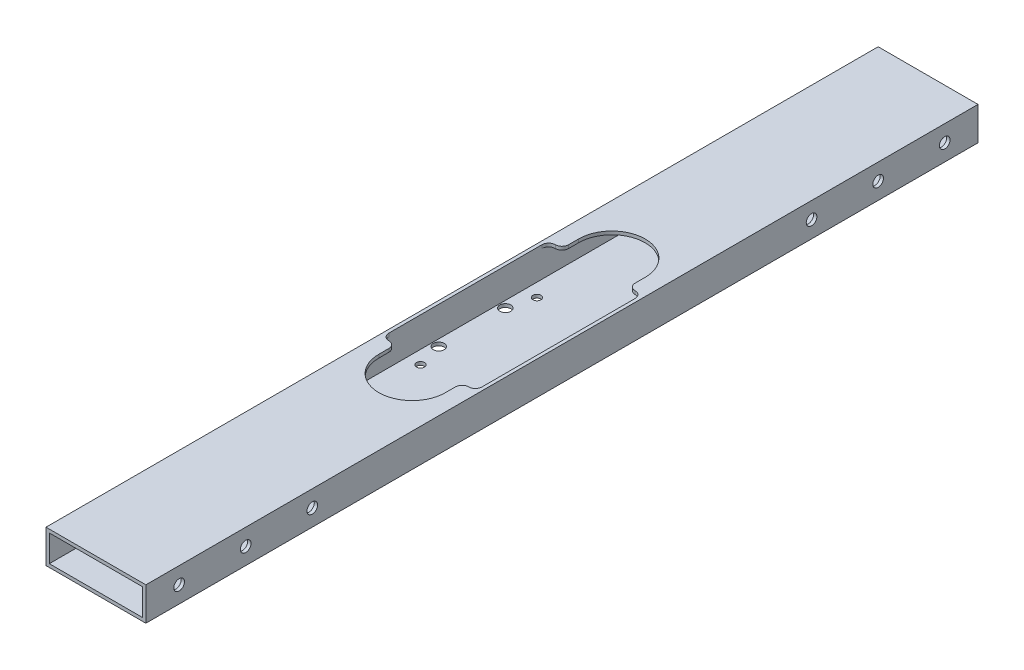
from build123d import *

# Parameters (mm, degrees)
SKETCH_1_W          = 30
SKETCH_1_H          = 10
SKETCH_1_W_2        = 27
SKETCH_1_H_2        = 7
EXTRUDE_1_DEPTH     = 250
SKETCH_2_R          = 1.6
CUT_EXTRUDE_1_DEPTH = 252.843205189
SKETCH_6_W          = 28
SKETCH_6_H          = 8
CUT_EXTRUDE_5_DEPTH = 330
SKETCH_8_W          = 4
SKETCH_8_H          = 25
CUT_EXTRUDE_6_DEPTH = 5
SKETCH_10_R         = 1.65
SKETCH_10_W         = 40
SKETCH_10_H         = 39.7
CUT_EXTRUDE_7_DEPTH = 25
FILLET_1_R          = 2
SKETCH_11_R         = 1.2
CUT_EXTRUDE_8_DEPTH = 25


with BuildPart() as part:
    # 草图1 → 凸台-拉伸1 (new body)
    with BuildSketch(Plane.XY):
        Rectangle(SKETCH_1_W, SKETCH_1_H)
        Rectangle(SKETCH_1_W_2, SKETCH_1_H_2, mode=Mode.SUBTRACT)
    extrude(amount=EXTRUDE_1_DEPTH)

    # 草图2 → 切除-拉伸1 (cut, through all)
    with BuildSketch(Plane(origin=(15, 0, 0), x_dir=(0, 0, -1), z_dir=(1, 0, 0))):
        with Locations((-240, 0)):
            Circle(SKETCH_2_R)
        with Locations((-220, 0)):
            Circle(SKETCH_2_R)
        with Locations((-200, 0)):
            Circle(SKETCH_2_R)
        with Locations((-50, 0)):
            Circle(SKETCH_2_R)
        with Locations((-30, 0)):
            Circle(SKETCH_2_R)
        with Locations((-10, 0)):
            Circle(SKETCH_2_R)
    extrude(amount=-CUT_EXTRUDE_1_DEPTH, mode=Mode.SUBTRACT)

    # 草图6 → 切除-拉伸5 (cut)
    with BuildSketch(Plane(origin=(0, 0, 0), x_dir=(-1, 0, 0), z_dir=(0, 0, -1))):
        Rectangle(SKETCH_6_W, SKETCH_6_H)
    extrude(amount=-CUT_EXTRUDE_5_DEPTH, mode=Mode.SUBTRACT)

    # 草图8 → 切除-拉伸6 (cut)
    with BuildSketch(Plane(origin=(0, 5, 0), x_dir=(1, 0, 0), z_dir=(0, 1, 0))):
        with BuildLine():
            Line((-10, -150), (-10, -155))
            ThreePointArc((-10, -155), (-7.071067812, -162.071067812), (0, -165))
            Line((0, -165), (0, -85))
            ThreePointArc((0, -85), (-7.071067812, -87.928932188), (-10, -95))
            Line((-10, -95), (-10, -100))
            Line((-10, -100), (-10, -125))
            Line((-10, -125), (-10, -150))
        make_face()
        with BuildLine():
            Line((0, -85), (0, -165))
            ThreePointArc((0, -165), (7.071067812, -162.071067812), (10, -155))
            Line((10, -155), (10, -150))
            Line((10, -150), (10, -125))
            Line((10, -125), (10, -100))
            Line((10, -100), (10, -95))
            ThreePointArc((10, -95), (7.071067812, -87.928932188), (0, -85))
        make_face()
        with Locations((12, -112.5)):
            Rectangle(SKETCH_8_W, SKETCH_8_H)
        with Locations((12, -137.5)):
            Rectangle(SKETCH_8_W, SKETCH_8_H)
        with Locations((-12, -112.5)):
            Rectangle(SKETCH_8_W, SKETCH_8_H)
        with Locations((-12, -137.5)):
            Rectangle(SKETCH_8_W, SKETCH_8_H)
    extrude(amount=-CUT_EXTRUDE_6_DEPTH, mode=Mode.SUBTRACT)

    # 草图10 → 切除-拉伸7 (cut)
    # profile 1 of 4: a face of its own
    with BuildSketch(Plane.XZ.offset(5)):
        with Locations(Location((-12, 115, 0), (0, 0, 270))):
            Circle(SKETCH_10_R)
    # profile 2 of 4: a face of its own
    with BuildSketch(Plane.XZ.offset(5)):
        with Locations(Location((-12, 135, 0), (0, 0, 270))):
            Circle(SKETCH_10_R)
    # profile 3 of 4: a face of its own
    with BuildSketch(Plane.XZ.offset(5)):
        with Locations(Location((11.7, 125, 0), (0, 0, 270))):
            Circle(SKETCH_10_R)
    # profile 4 of 4: a face of its own
    with BuildSketch(Plane.XZ.offset(5)):
        with Locations((-84.485896168, 54.669789624)):
            Rectangle(SKETCH_10_W, SKETCH_10_H)
        with Locations((-84.485896168, 42.819789624)):
            Circle(SKETCH_10_R, mode=Mode.SUBTRACT)
        with Locations((-94.485896168, 66.519789624)):
            Circle(SKETCH_10_R, mode=Mode.SUBTRACT)
        with Locations((-74.485896168, 66.519789624)):
            Circle(SKETCH_10_R, mode=Mode.SUBTRACT)
    extrude(amount=-CUT_EXTRUDE_7_DEPTH, mode=Mode.SUBTRACT)

    # 圆角1
    fillet_1_edges = [part.edges().sort_by_distance(p)[0] for p in [
        (-14, 4.5, 150),
        (14, 4.5, 150),
        (14, 4.5, 100),
        (-14, 4.5, 100),
    ]]
    fillet(fillet_1_edges, radius=FILLET_1_R)
    fillet_1_2_edges = [part.edges().sort_by_distance(p)[0] for p in [
        (10, 4.5, 100),
        (-10, 4.5, 100),
        (-10, 4.5, 150),
        (10, 4.5, 150),
    ]]
    fillet(fillet_1_2_edges, radius=FILLET_1_R - 0.0001)  # a hair under: the kernel refuses the full size

    # 草图11 → 切除-拉伸8 (cut)
    with BuildSketch(Plane.XZ.offset(5)):
        with Locations(Location((-10, 142.5, 0), (0, 0, 270))):
            Circle(SKETCH_11_R)
        with Locations(Location((10, 142.5, 0), (0, 0, 270))):
            Circle(SKETCH_11_R)
        with Locations(Location((10, 107.5, 0), (0, 0, 270))):
            Circle(SKETCH_11_R)
        with Locations(Location((-10, 107.5, 0), (0, 0, 270))):
            Circle(SKETCH_11_R)
    extrude(amount=-CUT_EXTRUDE_8_DEPTH, mode=Mode.SUBTRACT)


solid = part.part
